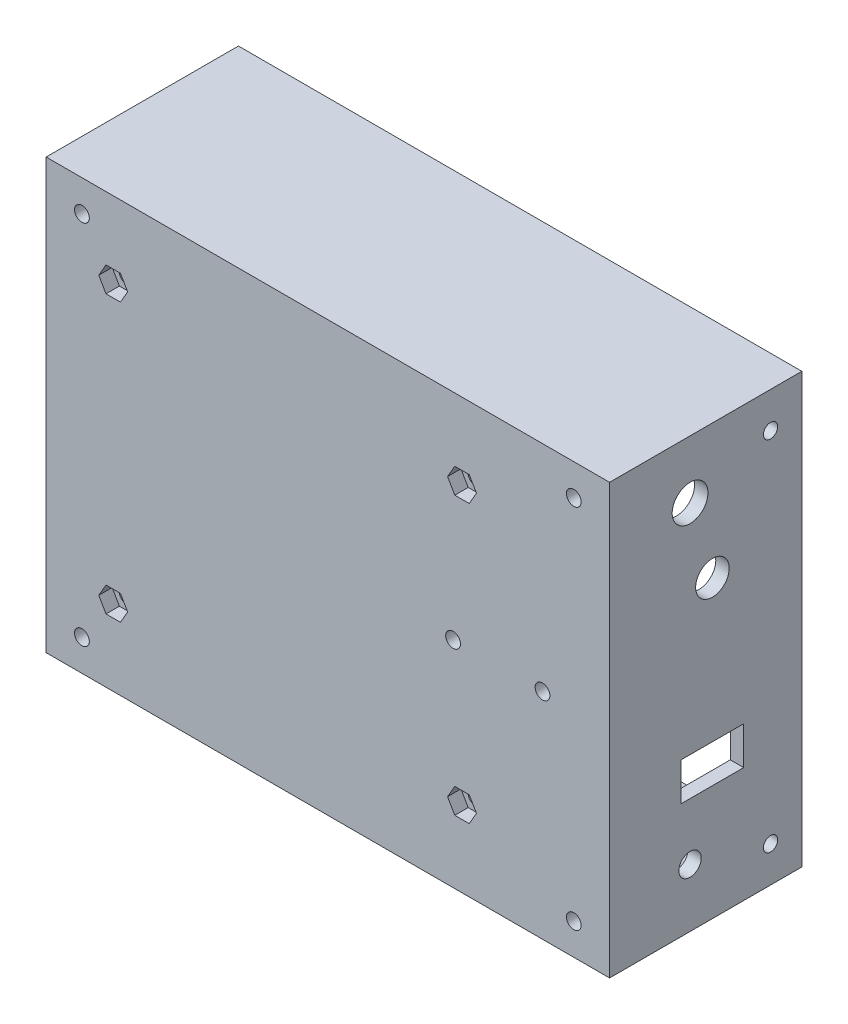
from build123d import *
from build123d.topology import SkipClean

# Parameters (mm, degrees)
SKETCH1_W            = 119.99999999999999
SKETCH1_H            = 90
SKETCH1_R            = 1.6499999999999952
SKETCH1_R_2          = 1.6500000000000028
SKETCH1_R_3          = 1.6500000000000017
BOSS_EXTRUDE2_DEPTH  = 4
SKETCH2_W            = 125.99999999999994
SKETCH2_H            = 95.99999999999996
SKETCH2_W_2          = 119.99999999999991
SKETCH2_H_2          = 89.99999999999997
BOSS_EXTRUDE3_DEPTH  = 43
CUT_EXTRUDE1_REACH   = 142.36
SKETCH3_R            = 1.6000000000000008
SKETCH4_R            = 3.7499999999999996
SKETCH4_W            = 14
SKETCH4_H            = 8.500000000000002
CUT_EXTRUDE3_DEPTH   = 10
SKETCH5_R            = 4.0000000000000036
CUT_EXTRUDE4_DEPTH   = 10
SKETCH6_R            = 2.499999999999999
CUT_EXTRUDE5_DEPTH   = 10
SKETCH8_R            = 1.6500000000000021
SKETCH8_R_2          = 1.6499999999999986
CUT_EXTRUDE6_DEPTH   = 10
BOSS_EXTRUDE4_DEPTH  = 3
CUT_EXTRUDE8_DEPTH   = 3
BOSS_EXTRUDE11_START = 5
SKETCH12_R           = 3.999999999999999
SKETCH12_R_2         = 1.6500000000000028
SKETCH12_R_3         = 4.000000000000005
SKETCH12_R_4         = 1.6499999999999952
SKETCH12_R_5         = 4.000000000000013
BOSS_EXTRUDE11_DEPTH = 5
SKETCH13_W           = 16
SKETCH13_H           = 16.00000000000001
SKETCH13_W_2         = 9.999999999999998
SKETCH13_H_2         = 12.000000000000004
BOSS_EXTRUDE12_DEPTH = 1
CHAMFER1_SIZE        = 1
SKETCH16_R           = 4.000000000000013
SKETCH16_R_2         = 3.999999999999999
CUT_EXTRUDE11_DEPTH  = 3
CUT_EXTRUDE13_DEPTH  = 2
SKETCH20_W           = 55.49999999999998
SKETCH20_H           = 14.999999999999996
CUT_EXTRUDE14_DEPTH  = 2
CUT_EXTRUDE15_DEPTH  = 2
CHAMFER6_SIZE        = 1.5


with BuildPart() as part:
    # Sketch1 → Boss-Extrude2 (new body)
    with BuildSketch(Plane.XY):
        Rectangle(SKETCH1_W, SKETCH1_H)
        with Locations((-47.99999999999999, 31)):
            Circle(SKETCH1_R, mode=Mode.SUBTRACT)
        with Locations((30.000000000000007, 31)):
            Circle(SKETCH1_R, mode=Mode.SUBTRACT)
        with Locations((29.999999999999993, -31)):
            Circle(SKETCH1_R_2, mode=Mode.SUBTRACT)
        with Locations((-47.99999999999999, -31)):
            Circle(SKETCH1_R_2, mode=Mode.SUBTRACT)
        with Locations((-54.99999999999998, 40.99999999999999)):
            Circle(SKETCH1_R_3, mode=Mode.SUBTRACT)
        with Locations((55.000000000000014, 40.99999999999999)):
            Circle(SKETCH1_R, mode=Mode.SUBTRACT)
        with Locations((55.000000000000014, -40.99999999999999)):
            Circle(SKETCH1_R, mode=Mode.SUBTRACT)
        with Locations((-54.99999999999998, -40.99999999999999)):
            Circle(SKETCH1_R_3, mode=Mode.SUBTRACT)
    extrude(amount=BOSS_EXTRUDE2_DEPTH)

    # Sketch2 → Boss-Extrude3 (add)
    with BuildSketch(Plane.XY.offset(4)):
        Rectangle(SKETCH2_W, SKETCH2_H)
        Rectangle(SKETCH2_W_2, SKETCH2_H_2, mode=Mode.SUBTRACT)
    extrude(amount=-BOSS_EXTRUDE3_DEPTH)

    # Cut-Extrude1: up to this face of the body (flat: up to its plane)
    cut_extrude1_end = Plane(part.part.faces().sort_by_distance((63, 0, -17.5))[0])
    # Sketch3 → Cut-Extrude1 (cut, up to the picked face)
    with BuildSketch(Plane.ZY.offset(62.99999999999997), mode=Mode.PRIVATE) as cut_extrude1_sk1:
        with Locations(Location((-31.999999999999993, -39.99999999999998, 0), (0, 0, 180))):
            Circle(SKETCH3_R)
    cut_extrude1_tool1 = split(extrude(cut_extrude1_sk1.sketch, amount=-CUT_EXTRUDE1_REACH, mode=Mode.PRIVATE), bisect_by=cut_extrude1_end, keep=Keep.BOTH, mode=Mode.PRIVATE)
    # Sketch3 → Cut-Extrude1 (cut, up to the picked face)
    with BuildSketch(Plane.ZY.offset(62.99999999999997), mode=Mode.PRIVATE) as cut_extrude1_sk2:
        with Locations(Location((-31.999999999999993, 39.99999999999997, 0), (0, 0, 180))):
            Circle(SKETCH3_R)
    cut_extrude1_tool2 = split(extrude(cut_extrude1_sk2.sketch, amount=-CUT_EXTRUDE1_REACH, mode=Mode.PRIVATE), bisect_by=cut_extrude1_end, keep=Keep.BOTH, mode=Mode.PRIVATE)
    add(cut_extrude1_tool1.solids().sort_by(Axis((-63, -40, -32), (1, 0, 0)))[0], mode=Mode.SUBTRACT)
    add(cut_extrude1_tool2.solids().sort_by(Axis((-63, 40, -32), (1, 0, 0)))[0], mode=Mode.SUBTRACT)

    # Sketch4 → Cut-Extrude3 (cut)
    with BuildSketch(Plane(origin=(62.99999999999997, 0, 0), x_dir=(0, 0, -1), z_dir=(1, 0, 0))):
        with Locations((18.999999999999993, 17.999999999999968)):
            Circle(SKETCH4_R)
        with Locations((18.999999999999993, -17.999999999999982)):
            Rectangle(SKETCH4_W, SKETCH4_H)
    extrude(amount=-CUT_EXTRUDE3_DEPTH, mode=Mode.SUBTRACT)

    # Sketch5 → Cut-Extrude4 (cut)
    with BuildSketch(Plane(origin=(62.99999999999997, 0, 0), x_dir=(0, 0, -1), z_dir=(1, 0, 0))):
        with Locations((13.999999999999991, 34.999999999999986)):
            Circle(SKETCH5_R)
    extrude(amount=-CUT_EXTRUDE4_DEPTH, mode=Mode.SUBTRACT)

    # Sketch6 → Cut-Extrude5 (cut)
    with BuildSketch(Plane(origin=(62.99999999999997, 0, 0), x_dir=(0, 0, -1), z_dir=(1, 0, 0))):
        with Locations((13.999999999999991, -34.999999999999986)):
            Circle(SKETCH6_R)
    extrude(amount=-CUT_EXTRUDE5_DEPTH, mode=Mode.SUBTRACT)

    # Sketch8 → Cut-Extrude6 (cut)
    with BuildSketch(Plane(origin=(0, 0, 0), x_dir=(-1, 0, 0), z_dir=(0, 0, -1))):
        with Locations((-47.99999999999994, 0)):
            Circle(SKETCH8_R)
        with Locations((-27.999999999999947, 0)):
            Circle(SKETCH8_R_2)
    extrude(amount=-CUT_EXTRUDE6_DEPTH, mode=Mode.SUBTRACT)

    # Sketch9 → Boss-Extrude4 (add)
    # profile 1 of 6: a face of its own
    with BuildSketch(Plane(origin=(0, 0, 0), x_dir=(-1, 0, 0), z_dir=(0, 0, -1))):
        Polygon((-45.22871870788974, 4.800000000000001), (-50.77128129211015, 4.800000000000001), (-53.542562584220356, 0), (-50.77128129211015, -4.800000000000001), (-45.22871870788974, -4.800000000000001), (-42.45743741577954, -8.7e-16), align=None)
        Polygon((-46.38341924626899, 2.8000000000000003), (-49.6165807537309, 2.8000000000000003), (-51.23316150746185, 4.3e-16), (-49.6165807537309, -2.8000000000000003), (-46.38341924626899, -2.8000000000000003), (-44.76683849253804, 2.17e-15), align=None, mode=Mode.SUBTRACT)
    # profile 2 of 6: a face of its own
    with BuildSketch(Plane(origin=(0, 0, 0), x_dir=(-1, 0, 0), z_dir=(0, 0, -1))):
        Polygon((-25.22871870788974, 4.800000000000001), (-30.77128129211015, 4.800000000000001), (-33.54256258422035, 2.6e-15), (-30.771281292110146, -4.800000000000001), (-25.228718707889737, -4.800000000000001), (-22.457437415779534, -2.6e-15), align=None)
        Polygon((-26.38341924626899, 2.8000000000000003), (-29.616580753730897, 2.8000000000000003), (-31.233161507461848, 0), (-29.616580753730897, -2.8000000000000003), (-26.383419246268993, -2.8000000000000003), (-24.76683849253804, 4.77e-15), align=None, mode=Mode.SUBTRACT)
    # profile 3 of 6: a face of its own
    with BuildSketch(Plane(origin=(0, 0, 0), x_dir=(-1, 0, 0), z_dir=(0, 0, -1))):
        Polygon((-50.61213795415884, 40.99999999999999), (-52.80606897707942, 44.800000000000004), (-57.1939310229206, 44.800000000000004), (-59.387862045841175, 40.99999999999999), (-57.19393102292058, 37.19999999999996), (-52.80606897707943, 37.19999999999996), align=None)
        Polygon((-51.76683849253809, 40.999999999999986), (-53.38341924626905, 43.800000000000004), (-56.61658075373096, 43.800000000000004), (-58.233161507461915, 40.99999999999999), (-56.61658075373094, 38.19999999999996), (-53.38341924626905, 38.19999999999996), align=None, mode=Mode.SUBTRACT)
    # profile 4 of 6: a face of its own
    with BuildSketch(Plane(origin=(0, 0, 0), x_dir=(-1, 0, 0), z_dir=(0, 0, -1))):
        Polygon((52.806068977079384, 44.8), (50.6121379541588, 40.99999999999998), (52.80606897707936, 37.199999999999996), (57.193931022920566, 37.199999999999996), (59.38786204584114, 40.99999999999999), (57.19393102292056, 44.8), align=None)
        Polygon((58.23316150746189, 41.00000000000001), (56.61658075373092, 43.800000000000004), (53.38341924626902, 43.800000000000004), (51.766838492538064, 40.99999999999999), (53.38341924626901, 38.2), (56.61658075373092, 38.2), align=None, mode=Mode.SUBTRACT)
    # profile 5 of 6: a face of its own
    with BuildSketch(Plane(origin=(0, 0, 0), x_dir=(-1, 0, 0), z_dir=(0, 0, -1))):
        Polygon((50.61213795415881, -40.999999999999986), (52.80606897707939, -44.800000000000004), (57.19393102292057, -44.800000000000004), (59.38786204584115, -40.999999999999986), (57.19393102292057, -37.19999999999998), (52.806068977079384, -37.19999999999998), align=None)
        Polygon((53.383419246269035, -38.199999999999996), (51.76683849253808, -41), (53.38341924626903, -43.79999999999999), (56.61658075373092, -43.79999999999999), (58.23316150746189, -40.99999999999998), (56.616580753730936, -38.199999999999996), align=None, mode=Mode.SUBTRACT)
    # profile 6 of 6: a face of its own
    with BuildSketch(Plane(origin=(0, 0, 0), x_dir=(-1, 0, 0), z_dir=(0, 0, -1))):
        Polygon((-52.806068977079434, -37.19999999999998), (-57.193931022920594, -37.19999999999998), (-59.387862045841175, -40.99999999999999), (-57.1939310229206, -44.8), (-52.80606897707945, -44.8), (-50.61213795415887, -40.99999999999997), align=None)
        Polygon((-53.383419246269064, -38.199999999999996), (-56.616580753730965, -38.199999999999996), (-58.23316150746191, -40.999999999999986), (-56.616580753730965, -43.799999999999976), (-53.38341924626907, -43.799999999999976), (-51.76683849253812, -40.99999999999998), align=None, mode=Mode.SUBTRACT)
    extrude(amount=BOSS_EXTRUDE4_DEPTH)

    # Sketch10 → Cut-Extrude8 (cut)
    with BuildSketch(Plane.XY.offset(4)):
        Polygon((-44.76683849253808, 30.999999999999993), (-46.383419246269035, 33.800000000000004), (-49.61658075373094, 33.800000000000004), (-51.23316150746191, 30.999999999999993), (-49.61658075373094, 28.19999999999998), (-46.383419246269035, 28.19999999999998), align=None)
        Polygon((33.23316150746191, 31.00000000000001), (31.616580753730965, 33.8), (28.38341924626906, 33.8), (26.766838492538106, 30.99999999999999), (28.383419246269046, 28.20000000000001), (31.616580753730958, 28.20000000000001), align=None)
        Polygon((-44.76683849253809, -31.00000000000001), (-46.38341924626904, -28.200000000000006), (-49.61658075373093, -28.200000000000006), (-51.23316150746188, -30.999999999999996), (-49.616580753730915, -33.80000000000001), (-46.38341924626904, -33.80000000000001), align=None)
        Polygon((33.23316150746189, -30.999999999999996), (31.616580753730943, -28.199999999999992), (28.383419246269042, -28.199999999999992), (26.76683849253808, -31.00000000000001), (28.383419246269025, -33.79999999999999), (31.616580753730943, -33.79999999999999), align=None)
    extrude(amount=-CUT_EXTRUDE8_DEPTH, mode=Mode.SUBTRACT)

    # Sketch12 → Boss-Extrude11 (add)
    # profile 1 of 4: a face of its own
    with SkipClean():  # the faces are left unmerged after this step: merging them gives an invalid solid
        with BuildSketch(Plane(origin=(0, 0, 0), x_dir=(-1, 0, 0), z_dir=(0, 0, -1)).offset(BOSS_EXTRUDE11_START)):
            with Locations(Location((-29.999999999999993, -31, 0), (0, 0, 180))):
                Circle(SKETCH12_R)
            with Locations((-29.999999999999993, -31)):
                Circle(SKETCH12_R_2, mode=Mode.SUBTRACT)
        # profile 2 of 4: a face of its own
        with BuildSketch(Plane(origin=(0, 0, 0), x_dir=(-1, 0, 0), z_dir=(0, 0, -1)).offset(BOSS_EXTRUDE11_START)):
            with Locations(Location((47.99999999999999, -31, 0), (0, 0, 180))):
                Circle(SKETCH12_R_3)
            with Locations((47.99999999999999, -31)):
                Circle(SKETCH12_R_4, mode=Mode.SUBTRACT)
        # profile 3 of 4: a face of its own
        with BuildSketch(Plane(origin=(0, 0, 0), x_dir=(-1, 0, 0), z_dir=(0, 0, -1)).offset(BOSS_EXTRUDE11_START)):
            with Locations(Location((47.99999999999999, 31, 0), (0, 0, 180))):
                Circle(SKETCH12_R_5)
            with Locations((47.99999999999999, 31)):
                Circle(SKETCH12_R_4, mode=Mode.SUBTRACT)
        # profile 4 of 4: a face of its own
        with BuildSketch(Plane(origin=(0, 0, 0), x_dir=(-1, 0, 0), z_dir=(0, 0, -1)).offset(BOSS_EXTRUDE11_START)):
            with Locations(Location((-30.000000000000007, 31, 0), (0, 0, 180))):
                Circle(SKETCH12_R_5)
            with Locations((-30.000000000000007, 31)):
                Circle(SKETCH12_R_4, mode=Mode.SUBTRACT)
        extrude(amount=-BOSS_EXTRUDE11_DEPTH)

    # Sketch16 → Cut-Extrude11 (cut)
    # profile 1 of 4: a face of its own
    with SkipClean():  # the faces are left unmerged after this step: merging them gives an invalid solid
        with BuildSketch(Plane(origin=(0, 0, 0), x_dir=(-1, 0, 0), z_dir=(0, 0, -1))):
            Polygon((-1.500000000000007, 41.99999999999999), (-50.61213795415888, 41.99999999999999), (-50.61213795415888, 40.99999999999999), (-52.80606897707943, 37.19999999999996), (-56.99999999999996, 37.19999999999996), (-56.99999999999995, 4.800000000000004), (-24.3626933041053, 4.800000000000001), (-22.457437415779534, 1.4999999999999973), (-1.5, 1.4999999999999973), align=None)
            with Locations((-30.000000000000007, 31)):
                Circle(SKETCH16_R, mode=Mode.SUBTRACT)
        # profile 2 of 4: a face of its own
        with BuildSketch(Plane(origin=(0, 0, 0), x_dir=(-1, 0, 0), z_dir=(0, 0, -1))):
            with BuildLine():
                Line((43.999999999999986, 41.99999999999999), (1.500000000000007, 41.99999999999999))
                Line((1.5000000000000053, 42), (1.500000000000005, 1.5))
                Line((1.5000000000000036, 1.4999999999999973), (56.99999999999997, 1.4999999999999973))
                Line((56.99999999999998, 1.4999999999999964), (56.99999999999998, 26.999999999999993))
                Line((56.99999999999998, 26.999999999999993), (47.249999999999986, 26.999999999999986))
                ThreePointArc((47.249999999999986, 26.999999999999986), (44.951902961143716, 27.951902961143713), (43.99999999999999, 30.24999999999999))
                Line((43.99999999999999, 30.24999999999999), (43.99999999999999, 41.99999999999999))
            make_face()
        # profile 3 of 4: a face of its own
        with BuildSketch(Plane(origin=(0, 0, 0), x_dir=(-1, 0, 0), z_dir=(0, 0, -1))):
            Polygon((-1.499999999999995, -42.00000000000001), (-1.4999999999999998, -1.500000000000007), (-22.45743741577953, -1.500000000000011), (-24.362693304105292, -4.800000000000002), (-56.99999999999996, -4.800000000000005), (-56.99999999999994, -37.19999999999998), (-52.806068977079434, -37.19999999999998), (-50.61213795415887, -40.99999999999997), (-50.61213795415887, -42.00000000000001), align=None)
            with Locations((-29.999999999999993, -31)):
                Circle(SKETCH16_R_2, mode=Mode.SUBTRACT)
        # profile 4 of 4: a face of its own
        with BuildSketch(Plane(origin=(0, 0, 0), x_dir=(-1, 0, 0), z_dir=(0, 0, -1))):
            with BuildLine():
                Line((56.99999999999998, -1.5000000000000013), (1.500000000000007, -1.5000000000000082))
                Line((1.5000000000000049, -1.500000000000007), (1.5000000000000047, -42))
                Line((1.500000000000007, -42), (44, -41.99999999999999))
                Line((44, -41.99999999999999), (44, -30.249999999999996))
                ThreePointArc((44, -30.249999999999996), (44.95190296114372, -27.95190296114372), (47.25, -26.999999999999996))
                Line((47.25, -26.999999999999996), (56.999999999999986, -26.999999999999986))
                Line((56.999999999999986, -26.999999999999986), (56.999999999999986, -1.5))
            make_face()
        extrude(amount=-CUT_EXTRUDE11_DEPTH, mode=Mode.SUBTRACT)

    # Sketch17 → Cut-Extrude13 (cut)
    with SkipClean():  # the faces are left unmerged after this step: merging them gives an invalid solid
        with BuildSketch(Plane.XZ.offset(-45)):
            Polygon((-56.99999999999997, -20.999999999999996), (-56.99999999999997, -35.99999999999999), (-1.5, -35.99999999999999), (-1.500000000000003, -20.999999999999996), align=None)
            Polygon((-56.99999999999997, -3), (-56.99999999999997, -18), (-1.5, -18), (-1.5000000000000053, -3), align=None)
            Polygon((1.499999999999995, -3), (1.4999999999999967, -18), (56.99999999999994, -18), (56.99999999999995, -3), align=None)
            Polygon((1.499999999999997, -20.999999999999996), (1.4999999999999987, -35.99999999999999), (56.99999999999996, -35.99999999999999), (56.99999999999996, -20.999999999999996), align=None)
        extrude(amount=-CUT_EXTRUDE13_DEPTH, mode=Mode.SUBTRACT)

    # Sketch20 → Cut-Extrude14 (cut)
    with SkipClean():  # the faces are left unmerged after this step: merging them gives an invalid solid
        with BuildSketch(Plane(origin=(0, -44.99999999999998, 0), x_dir=(1, 0, 0), z_dir=(0, 1, 0))):
            with Locations((-29.249999999999996, 28.499999999999993)):
                Rectangle(SKETCH20_W, SKETCH20_H)
            Polygon((56.99999999999994, 35.99999999999999), (1.5, 35.99999999999999), (1.4999999999999987, 20.999999999999996), (56.99999999999998, 20.999999999999996), align=None)
            Polygon((56.99999999999996, 18), (1.5, 18), (1.5000000000000009, 3), (56.999999999999936, 3.0000000000000027), align=None)
            Polygon((-1.500000000000007, 18), (-56.999999999999986, 18), (-56.99999999999998, 3), (-1.500000000000007, 3.0000000000000027), align=None)
        extrude(amount=-CUT_EXTRUDE14_DEPTH, mode=Mode.SUBTRACT)

    # Sketch21 → Cut-Extrude15 (cut)
    with SkipClean():  # the faces are left unmerged after this step: merging them gives an invalid solid
        with BuildSketch(Plane(origin=(-59.99999999999998, 0, 0), x_dir=(0, 0, -1), z_dir=(1, 0, 0))):
            Polygon((35.99999999999999, 36), (27.99999999999999, 36), (27.999999999999993, 1.499999999999993), (36, 1.499999999999992), align=None)
            Polygon((27.99999999999999, 36), (27.99999999999999, 41.99999999999999), (20.999999999999996, 41.99999999999999), (21, 1.499999999999993), (27.999999999999993, 1.499999999999993), align=None)
            Polygon((36, -1.5000000000000082), (27.999999999999993, -1.5000000000000073), (27.999999999999996, -35.99999999999998), (35.99999999999999, -35.99999999999998), align=None)
            Polygon((27.999999999999993, -1.5000000000000073), (21.000000000000004, -1.5000000000000067), (21.000000000000007, -41.99999999999999), (27.999999999999996, -41.999999999999964), (27.999999999999996, -35.99999999999998), align=None)
            Polygon((18.00000000000001, -41.99999999999999), (18.000000000000007, -1.500000000000007), (3.0000000000000058, -1.5000000000000049), (3.0000000000000098, -41.99999999999999), align=None)
            Polygon((18.000000000000004, 1.499999999999993), (18, 41.99999999999999), (3, 41.99999999999999), (3.0000000000000044, 1.499999999999993), align=None)
        extrude(amount=-CUT_EXTRUDE15_DEPTH, mode=Mode.SUBTRACT)

    # Chamfer6
    chamfer6_edges = [part.edges().sort_by_distance(p)[0] for p in [
        (29.24999999999998, 47, -35.99999999999999),
        (29.24999999999997, 47, -18),
        (-29.249999999999986, 47, -18),
        (-29.249999999999986, 47, -35.99999999999999),
        (-29.249999999999996, -46.99999999999998, -18),
        (29.24999999999998, -46.99999999999998, -18),
        (29.24999999999997, -46.99999999999998, -35.99999999999999),
        (-29.249999999999996, -46.99999999999998, -35.99999999999999),
        (-61.99999999999998, 21.749999999999993, -18),
        (-61.99999999999998, -21.75, -18.000000000000007),
        (-61.99999999999998, -18.74999999999999, -35.99999999999999),
        (-61.99999999999998, -38.99999999999997, -27.999999999999996),
        (-61.99999999999998, 18.749999999999996, -35.99999999999999),
        (-61.99999999999998, 38.99999999999999, -27.99999999999999),
    ]]
    chamfer(chamfer6_edges, length=CHAMFER6_SIZE)


with BuildPart() as body_2:
    # Sketch13 → Boss-Extrude12 (new body)
    with BuildSketch(Plane.ZY.offset(-59.99999999999996)):
        with Locations((-13.999999999999993, 34.99999999999998)):
            Rectangle(SKETCH13_W, SKETCH13_H)
        with Locations((-13.99999999999999, 34.99999999999998)):
            Rectangle(SKETCH13_W_2, SKETCH13_H_2, mode=Mode.SUBTRACT)
    extrude(amount=BOSS_EXTRUDE12_DEPTH)

    # Chamfer1
    chamfer1_edges = [body_2.edges().sort_by_distance(p)[0] for p in [
        (58.99999999999996, 34.999999999999986, -5.999999999999991),
        (58.99999999999996, 34.999999999999986, -21.999999999999993),
    ]]
    chamfer(chamfer1_edges, length=CHAMFER1_SIZE - 0.0001)  # a hair under: the kernel refuses the full size


solid = Compound([part.part, body_2.part])
